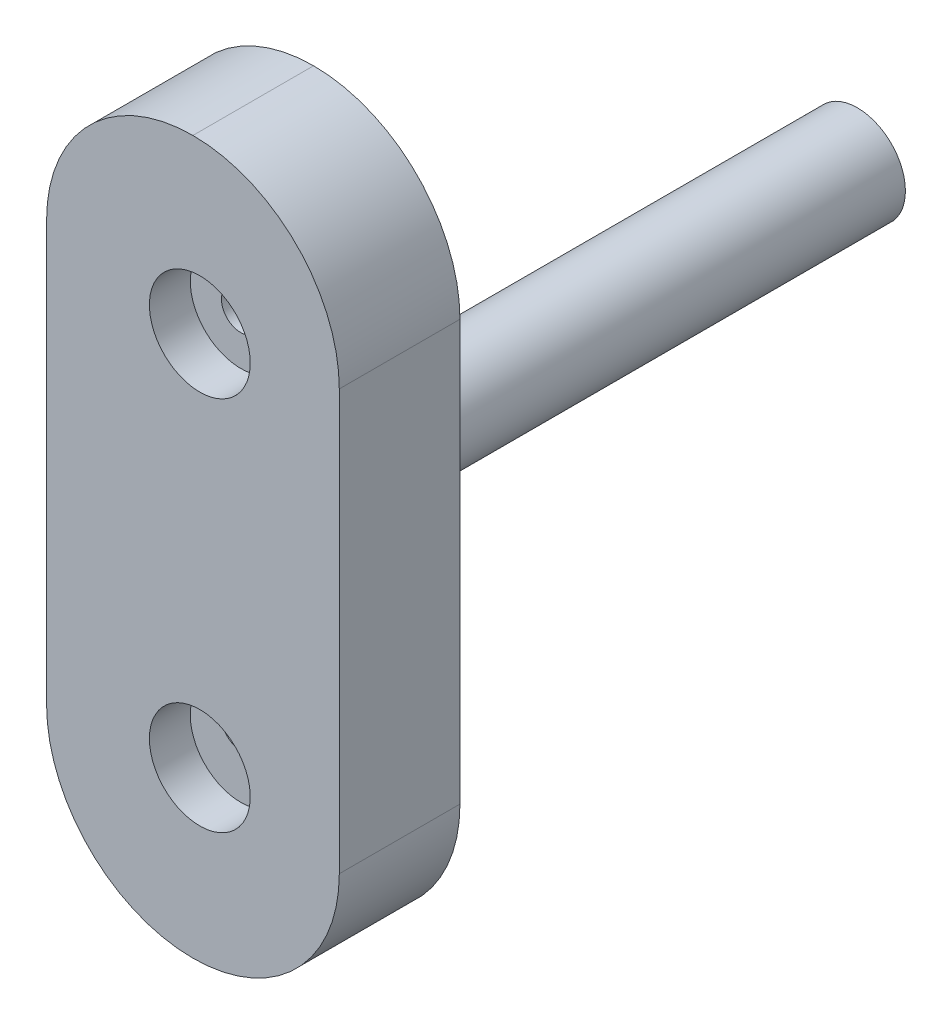
from build123d import *

# Parameters (mm, degrees)
SKETCH1_R             = 3.98
BOSS_EXTRUDE1_DEPTH   = 54.5
SKETCH3_W             = 24.26
SKETCH3_H             = 59.06
BOSS_EXTRUDE2_DEPTH   = 10
SKETCH4_R             = 1.6
CUT_EXTRUDE1_DEPTH    = 56.204619372
CROQUIS2_R            = 4.18
CORTAR_EXTRUIR2_DEPTH = 3.39
REDONDEO1_R           = 12.13


with BuildPart() as part:
    # Sketch1 → Boss-Extrude1 (new body)
    with BuildSketch(Plane.XY):
        Circle(SKETCH1_R)
    extrude(amount=BOSS_EXTRUDE1_DEPTH)

    # Sketch3 → Boss-Extrude2 (add)
    with BuildSketch(Plane.XY.offset(54.5)):
        with Locations((-0.57, -0.57)):
            Rectangle(SKETCH3_W, SKETCH3_H)
    extrude(amount=-BOSS_EXTRUDE2_DEPTH)

    # Sketch4 → Cut-Extrude1 (cut, through all)
    with BuildSketch(Plane(origin=(0, 0, 44.5), x_dir=(-1, 0, 0), z_dir=(0, 0, -1))):
        with Locations((0, 15)):
            Circle(SKETCH4_R)
        with Locations(Location((0, -15, 0), (0, 0, 180))):
            Circle(SKETCH4_R)
    extrude(amount=-CUT_EXTRUDE1_DEPTH, mode=Mode.SUBTRACT)

    # Croquis2 → Cortar-Extruir2 (cut)
    with BuildSketch(Plane.XY.offset(54.5)):
        with Locations((0, 15)):
            Circle(CROQUIS2_R)
        with Locations(Location((0, -16.14, 0), (0, 0, 180))):
            Circle(CROQUIS2_R)
    extrude(amount=-CORTAR_EXTRUIR2_DEPTH, mode=Mode.SUBTRACT)

    # Redondeo1
    redondeo1_edges = [part.edges().sort_by_distance(p)[0] for p in [
        (11.56, -30.1, 49.5),
        (-12.7, -30.1, 49.5),
        (-12.7, 28.96, 49.5),
        (11.56, 28.96, 49.5),
    ]]
    fillet(redondeo1_edges, radius=REDONDEO1_R - 0.0001)  # a hair under: the kernel refuses the full size


solid = part.part
